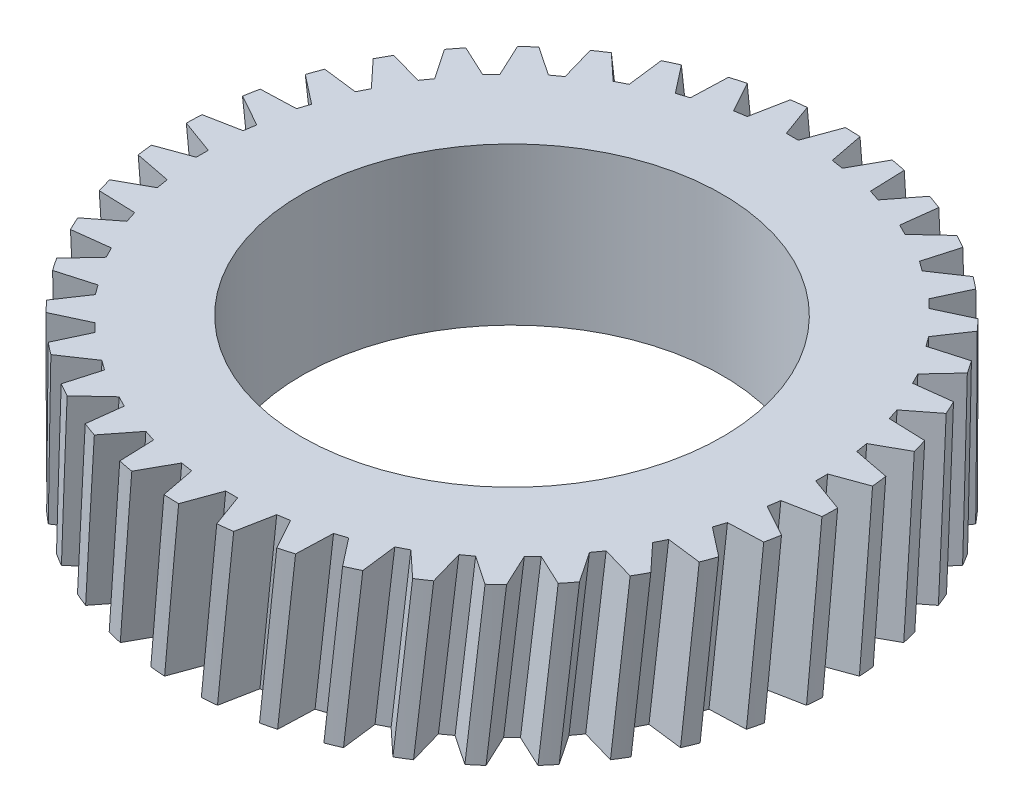
from build123d import *

# Parameters (mm, degrees)
SKETCH_1_R               = 31.5
SKETCH_1_R_2             = 20.1
EXTRUDE_1_DEPTH          = 15
PATTERN_CIRCULAR_4_COUNT = 40


with BuildPart() as part:
    # Эскиз1 → Бобышка-Вытянуть1 (new body)
    with BuildSketch(Plane(origin=(0, 0, 0), x_dir=(1, 0, 0), z_dir=(0, 1, 0))):
        Circle(SKETCH_1_R)
        Circle(SKETCH_1_R_2, mode=Mode.SUBTRACT)
    extrude(amount=EXTRUDE_1_DEPTH)

    # Вырез-По траектории4: sweep along a path in Эскиз8
    with BuildLine(Plane(origin=(30, 0, 0), x_dir=(0, 0, -1), z_dir=(1, 0, 0))) as sweep_4_path:
        Line((0, 0), (1.610154635, 17.19379209))
    # Эскиз7 → Вырез-По траектории4 (sweep, cut)
    with BuildSketch(Plane(origin=(0, 0, 0), x_dir=(1, 0, 0), z_dir=(0, 1, 0))):
        Polygon((28.2, -0.57191311), (28.2, 0.57191311), (32, 1.955), (32, -1.955), align=None)
    sweep_4 = sweep(path=sweep_4_path.line, mode=Mode.SUBTRACT)

    # Круговой массив4: Вырез-По траектории4 ×40 about axis
    pattern_circular_4_axis = Axis((0, 15, 0), (0, -1, 0))
    for i in range(1, PATTERN_CIRCULAR_4_COUNT):
        add(sweep_4.rotate(pattern_circular_4_axis, i * 360 / PATTERN_CIRCULAR_4_COUNT), mode=Mode.SUBTRACT)


solid = part.part
